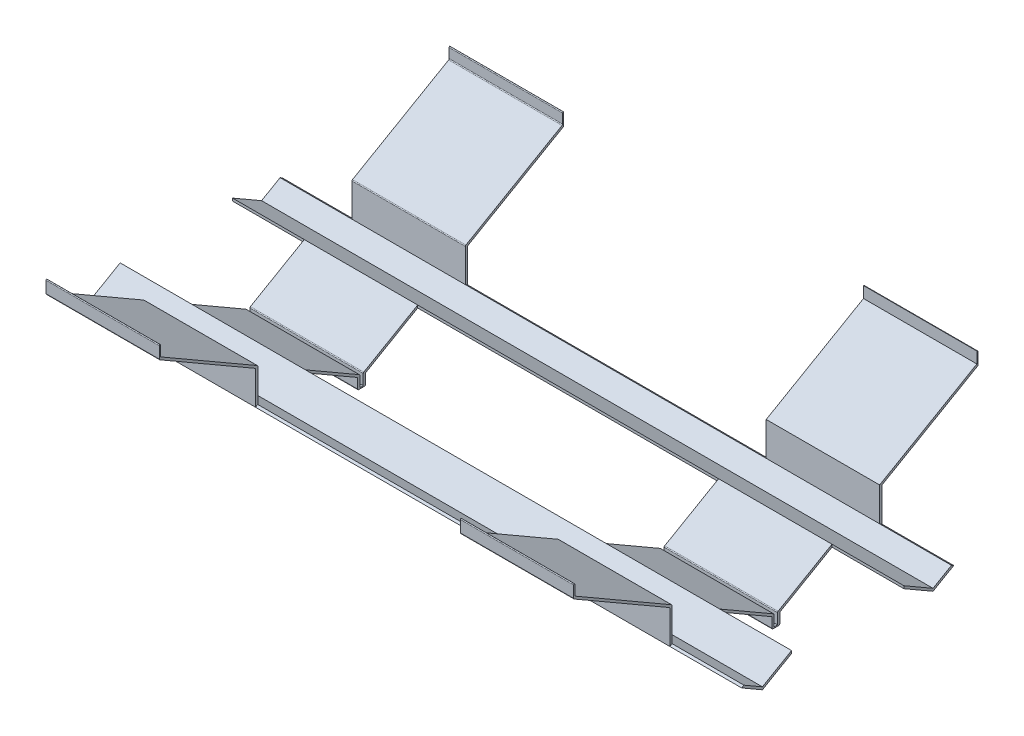
from build123d import *

# Parameters (mm, degrees)
BOSS_EXTRUDE1_DEPTH      = 505
BOSS_EXTRUDE3_DEPTH      = 1340
BOSS_EXTRUDE3_DEPTH_BACK = 825
BOSS_EXTRUDE4_DEPTH      = 505
BOSS_EXTRUDE5_DEPTH      = 320
FILLET1_R                = 5


with BuildPart() as part:
    # Sketch1 → Boss-Extrude1 (new body)
    with BuildSketch(Plane(origin=(0, 0, 0), x_dir=(0, 0, -1), z_dir=(1, 0, 0))):
        Polygon((-7.5, 5), (7.5, 5), (7.5, 55), (249.98711306, 195), (379.890923627, 120), (462.163336987, 167.5), (462.163336987, 317.5), (895.176038879, 567.5), (895.176038879, 617.5), (900.176038879, 617.5), (900.176038879, 558.839745962), (472.163336987, 311.726497308), (472.163336987, 161.726497308), (379.890923627, 108.452994616), (249.98711306, 183.452994616), (17.5, 49.226497308), (17.5, 0), (-17.5, 0), (-17.5, 49.226497308), (-249.98711306, 183.452994616), (-379.890923627, 108.452994616), (-472.163336987, 161.726497308), (-472.163336987, 311.726497308), (-900.176038879, 558.839745962), (-900.176038879, 617.5), (-895.176038879, 617.5), (-895.176038879, 567.5), (-462.163336987, 317.5), (-462.163336987, 167.5), (-379.890923627, 120), (-249.98711306, 195), (-7.5, 55), align=None)
    extrude(amount=BOSS_EXTRUDE1_DEPTH)

    # Sketch2 → Boss-Extrude3 (add, two sides: drawn at the far end of the back side and taken through both)
    with BuildSketch(Plane(origin=(505, 0, 0), x_dir=(0, 0, -1), z_dir=(1, 0, 0)).offset(-BOSS_EXTRUDE3_DEPTH_BACK)):
        Polygon((249.98711306, 195), (379.890923627, 120), (462.163336987, 167.5), (472.163336987, 161.726497308), (379.890923627, 108.452994616), (249.98711306, 183.452994616), align=None)
        Polygon((-462.163336987, 167.5), (-379.890923627, 120), (-249.98711306, 195), (-249.98711306, 183.452994616), (-379.890923627, 108.452994616), (-472.163336987, 161.726497308), align=None)
    extrude(amount=BOSS_EXTRUDE3_DEPTH + BOSS_EXTRUDE3_DEPTH_BACK)

    # Sketch4 → Boss-Extrude4 (add)
    with BuildSketch(Plane(origin=(1845, 0, 0), x_dir=(0, 0, -1), z_dir=(1, 0, 0))):
        Polygon((-900.176038879, 617.5), (-895.176038879, 617.5), (-895.176038879, 567.5), (-462.163336987, 317.5), (-462.163336987, 167.5), (-379.890923627, 120), (-249.98711306, 195), (-7.5, 55), (-7.5, 5), (7.5, 5), (7.5, 55), (249.98711306, 195), (379.890923627, 120), (462.163336987, 167.5), (462.163336987, 317.5), (895.176038879, 567.5), (895.176038879, 617.5), (900.176038879, 617.5), (900.176038879, 558.839745962), (472.163336987, 311.726497308), (472.163336987, 161.726497308), (379.890923627, 108.452994616), (249.98711306, 183.452994616), (17.5, 49.226497308), (17.5, 0), (-17.5, 0), (-17.5, 49.226497308), (-249.98711306, 183.452994616), (-379.890923627, 108.452994616), (-472.163336987, 161.726497308), (-472.163336987, 311.726497308), (-900.176038879, 558.839745962), align=None)
    extrude(amount=BOSS_EXTRUDE4_DEPTH)

    # Sketch5 → Boss-Extrude5 (add)
    with BuildSketch(Plane(origin=(2350, 0, 0), x_dir=(0, 0, -1), z_dir=(1, 0, 0))):
        Polygon((249.98711306, 195), (379.890923627, 120), (462.163336987, 167.5), (472.163336987, 161.726497308), (379.890923627, 108.452994616), (249.98711306, 183.452994616), align=None)
        Polygon((-462.163336987, 167.5), (-379.890923627, 120), (-249.98711306, 195), (-249.98711306, 183.452994616), (-379.890923627, 108.452994616), (-472.163336987, 161.726497308), align=None)
    extrude(amount=BOSS_EXTRUDE5_DEPTH)

    # Fillet1
    # the kernel refuses this fillet: 5 mm, written as the material it adds along each edge
    with BuildSketch(Plane(origin=(0, 567.5, -895.176038879), x_dir=(0, -0.4999999999999892, 0.8660254037844449), z_dir=(1, 0, 0)), Plane(origin=(0, 311.726497308, -472.163336987), x_dir=(0, 0.5000000000000101, -0.8660254037844327), z_dir=(1, 0, 0)), Plane(origin=(1845, 311.726497308, -472.163336987), x_dir=(0, 0.4999999999999846, -0.8660254037844476), z_dir=(1, 0, 0)), Plane(origin=(0, 311.726497308, 472.163336987), x_dir=(0, -1, 0), z_dir=(1, 0, 0)), Plane(origin=(1845, 311.726497308, 472.163336987), x_dir=(0, -1, 0), z_dir=(1, 0, 0)), Plane(origin=(0, 567.5, 895.176038879), x_dir=(0, 1, 0), z_dir=(1, 0, 0)), Plane(origin=(1845, 567.5, 895.176038879), x_dir=(0, 1, 0), z_dir=(1, 0, 0))) as fillet1_piece_1:
        with BuildLine():
            CenterArc((FILLET1_R * 0.57735026919, -FILLET1_R), FILLET1_R, 90, 60)
            Line((-FILLET1_R * 0.288675134595, -FILLET1_R * 0.5), (0, 0))
            Line((0, 0), (FILLET1_R * 0.57735026919, 0))
        make_face()
    extrude(amount=505)
    # the kernel refuses this fillet: 5 mm, written as the material it takes off along each edge
    with BuildSketch(Plane(origin=(-12.5, 617.5, -895.176038879), x_dir=(0, 0, -1), z_dir=(1, 0, 0)), Plane(origin=(-12.5, 617.5, -900.176038879), x_dir=(0, -1, 0), z_dir=(1, 0, 0)), Plane(origin=(1832.5, 617.5, -900.176038879), x_dir=(0, -1, 0), z_dir=(1, 0, 0)), Plane(origin=(-12.5, 617.5, 895.176038879), x_dir=(0, -1, 0), z_dir=(1, 0, 0)), Plane(origin=(-12.5, 617.5, 900.176038879), x_dir=(0, 0, -1), z_dir=(1, 0, 0)), Plane(origin=(1832.5, 617.5, 895.176038879), x_dir=(0, -1, 0), z_dir=(1, 0, 0)), Plane(origin=(-12.5, 0, 17.5), x_dir=(0, 1, 0), z_dir=(1, 0, 0)), Plane(origin=(-12.5, 0, -17.5), x_dir=(0, 0, 1), z_dir=(1, 0, 0)), Plane(origin=(1832.5, 0, -17.5), x_dir=(0, 0, 1), z_dir=(1, 0, 0)), Plane(origin=(1832.5, 0, 17.5), x_dir=(0, 1, 0), z_dir=(1, 0, 0))) as fillet1_2_piece_1:
        with BuildLine():
            CenterArc((FILLET1_R, -FILLET1_R), FILLET1_R, 90, 90)
            Line((0, -FILLET1_R), (0, 0))
            Line((0, 0), (FILLET1_R, 0))
        make_face()
    extrude(amount=530, mode=Mode.SUBTRACT)
    with BuildSketch(Plane(origin=(-7.216878365, 317.5, -462.163336987), x_dir=(0, -1, 0), z_dir=(1, 0, 0)), Plane(origin=(-7.216878365, 55, -7.5), x_dir=(0, -1, 0), z_dir=(1, 0, 0)), Plane(origin=(1837.783121635, 55, 7.5), x_dir=(0, 0.49999999999999023, 0.8660254037844441), z_dir=(1, 0, 0))) as fillet1_2_piece_2:
        with BuildLine():
            CenterArc((FILLET1_R * 0.57735026919, FILLET1_R), FILLET1_R, 210, 60)
            Line((-FILLET1_R * 0.288675134595, FILLET1_R * 0.5), (0, 0))
            Line((0, 0), (FILLET1_R * 0.57735026919, 0))
        make_face()
    extrude(amount=519.43375673, mode=Mode.SUBTRACT)
    with BuildSketch(Plane(origin=(-7.216878365, 558.839745962, -900.176038879), x_dir=(0, -0.5000000000000017, 0.8660254037844376), z_dir=(1, 0, 0)), Plane(origin=(1837.783121635, 558.839745962, -900.176038879), x_dir=(0, -0.5000000000000017, 0.8660254037844376), z_dir=(1, 0, 0)), Plane(origin=(1837.783121635, 317.5, 462.163336987), x_dir=(0, -1, 0), z_dir=(1, 0, 0)), Plane(origin=(-7.216878365, 317.5, 462.163336987), x_dir=(0, -1, 0), z_dir=(1, 0, 0)), Plane(origin=(-7.216878365, 558.839745962, 900.176038879), x_dir=(0, 1, 0), z_dir=(1, 0, 0)), Plane(origin=(1837.783121635, 558.839745962, 900.176038879), x_dir=(0, 1, 0), z_dir=(1, 0, 0)), Plane(origin=(-7.216878365, 55, 7.5), x_dir=(0, -1, 0), z_dir=(1, 0, 0)), Plane(origin=(1837.783121635, 55, -7.5), x_dir=(0, 0.49999999999999056, -0.8660254037844441), z_dir=(1, 0, 0))) as fillet1_2_piece_3:
        with BuildLine():
            CenterArc((FILLET1_R * 0.57735026919, -FILLET1_R), FILLET1_R, 90, 60)
            Line((-FILLET1_R * 0.288675134595, -FILLET1_R * 0.5), (0, 0))
            Line((0, 0), (FILLET1_R * 0.57735026919, 0))
        make_face()
    extrude(amount=519.43375673, mode=Mode.SUBTRACT)
    with BuildSketch(Plane(origin=(1832.5, 617.5, 900.176038879), x_dir=(0, -1, 0), z_dir=(1, 0, 0))) as fillet1_2_piece_4:
        with BuildLine():
            CenterArc((FILLET1_R, FILLET1_R), FILLET1_R, 180, 90)
            Line((0, FILLET1_R), (0, 0))
            Line((0, 0), (FILLET1_R, 0))
        make_face()
    extrude(amount=530, mode=Mode.SUBTRACT)


solid = part.part
